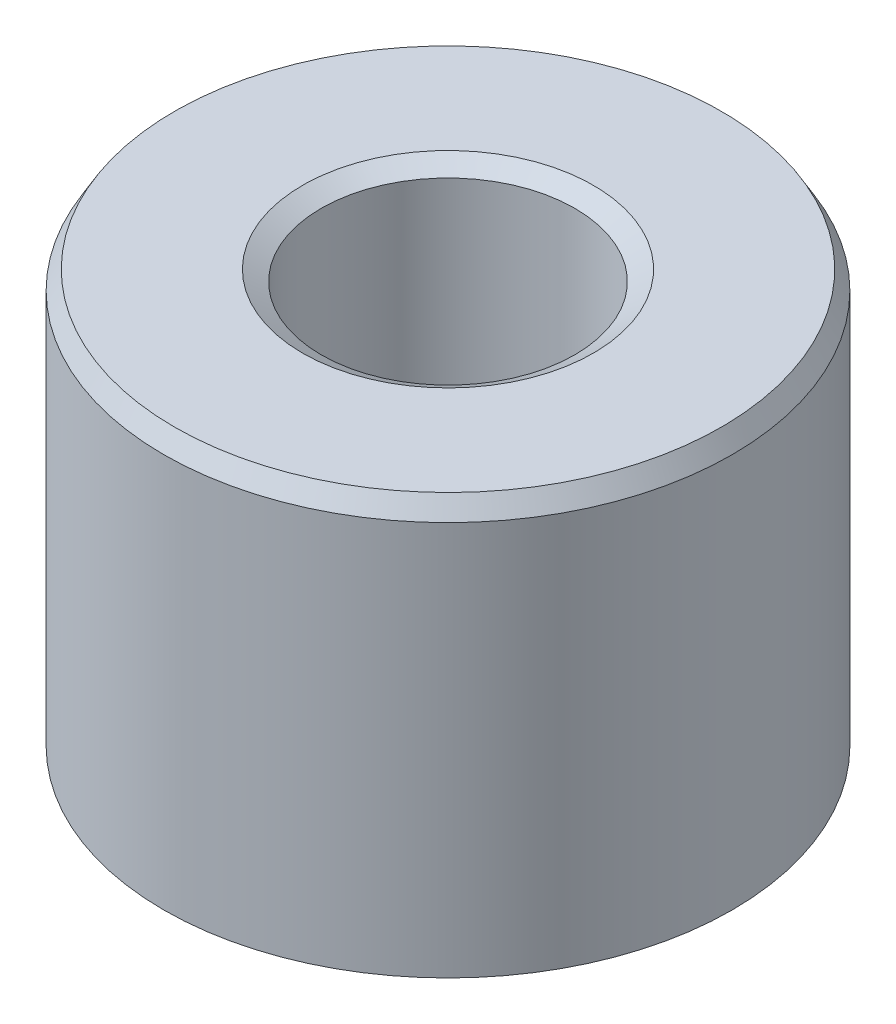
from build123d import *
from OCP.BRepFilletAPI import BRepFilletAPI_MakeChamfer

# Parameters (mm, degrees)
SKETCH1_R           = 50
BOSS_EXTRUDE1_DEPTH = 74.525377198
SKETCH2_R           = 22.322212598
CUT_EXTRUDE1_DEPTH  = 103.732817768
CHAMFER1_SIZE       = 3.260877544
CHAMFER1_SIZE2      = 1.882668528


with BuildPart() as part:
    # Sketch1 → Boss-Extrude1 (new body)
    with BuildSketch(Plane(origin=(0, 0, 0), x_dir=(1, 0, 0), z_dir=(0, 1, 0))):
        Circle(SKETCH1_R)
    extrude(amount=BOSS_EXTRUDE1_DEPTH)

    # Sketch2 → Cut-Extrude1 (cut, through all)
    with BuildSketch(Plane(origin=(0, 0, 0), x_dir=(1, 0, 0), z_dir=(0, 1, 0))):
        Circle(SKETCH2_R)
    extrude(amount=CUT_EXTRUDE1_DEPTH, mode=Mode.SUBTRACT)

    # Chamfer1: one chamfer whose edges measure the first distance from different faces: ONE call of the kernel's chamfer builder (chamfer() names one face for all edges)
    chamfer1_edges_1 = [part.edges().sort_by_distance(p)[0] for p in [
        (-22.322212598, 74.525377198, 0),
    ]]
    chamfer1_side_1 = [part.faces().sort_by_distance(p)[0] for p in [
        (-48.585786438, 74.525377198, 0),
    ]]
    chamfer1_edges_2 = [part.edges().sort_by_distance(p)[0] for p in [
        (-22.322212598, 0, 0),
    ]]
    chamfer1_side_2 = [part.faces().sort_by_distance(p)[0] for p in [
        (-22.322212598, 37.262688599, 0),
    ]]
    chamfer1_edges_3 = [part.edges().sort_by_distance(p)[0] for p in [
        (-50, 0, 0),
    ]]
    chamfer1_side_3 = [part.faces().sort_by_distance(p)[0] for p in [
        (-48.585786438, 0, 0),
    ]]
    chamfer1_edges_4 = [part.edges().sort_by_distance(p)[0] for p in [
        (-50, 74.525377198, 0),
    ]]
    chamfer1_side_4 = [part.faces().sort_by_distance(p)[0] for p in [
        (-50, 37.262688599, 0),
    ]]
    chamfer1 = BRepFilletAPI_MakeChamfer(part.part.solid().wrapped)
    for e in chamfer1_edges_1:
        chamfer1.Add(CHAMFER1_SIZE, CHAMFER1_SIZE2, e.wrapped, chamfer1_side_1[0].wrapped)  # the first distance lies on this face
    for e in chamfer1_edges_2:
        chamfer1.Add(CHAMFER1_SIZE, CHAMFER1_SIZE2, e.wrapped, chamfer1_side_2[0].wrapped)  # the first distance lies on this face
    for e in chamfer1_edges_3:
        chamfer1.Add(CHAMFER1_SIZE, CHAMFER1_SIZE2, e.wrapped, chamfer1_side_3[0].wrapped)  # the first distance lies on this face
    for e in chamfer1_edges_4:
        chamfer1.Add(CHAMFER1_SIZE, CHAMFER1_SIZE2, e.wrapped, chamfer1_side_4[0].wrapped)  # the first distance lies on this face
    add(Compound.cast(chamfer1.Shape()), mode=Mode.REPLACE)


solid = part.part
